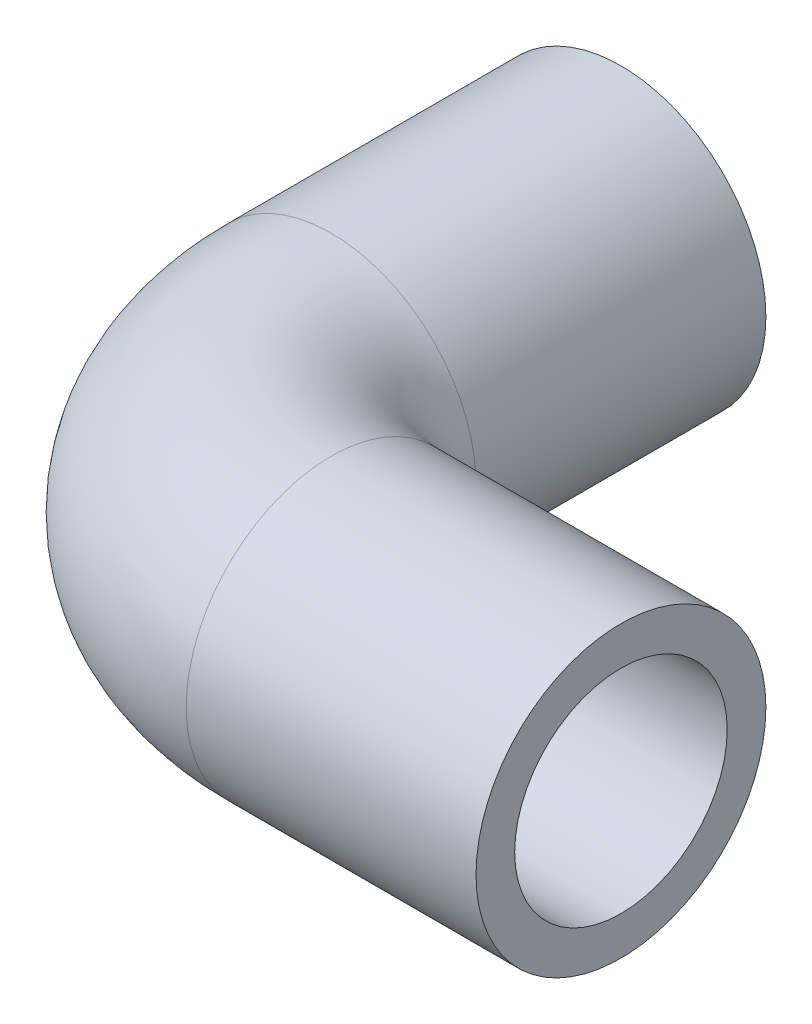
from build123d import *

# Parameters (mm, degrees)
SWEEP1_PROFILE_R   = 37.5
SHELL1_T           = -10
CUT_EXTRUDE1_REACH = 234.849


with BuildPart() as part:
    # Sweep1: sweep along a path in Sketch1
    with BuildLine(Plane(origin=(0, 0, 0), x_dir=(1, 0, 0), z_dir=(0, 1, 0))) as sweep1_path:
        Line((0, 0), (-75, 0))
        ThreePointArc((-75, 0), (-110.355339059, 14.644660941), (-125, 50))
        Line((-125, 50), (-125, 125))
    # Sweep1 profile (on start of the path) → Sweep1 (sweep)
    with BuildSketch(Plane(origin=(0, 0, 0), x_dir=(0, 0, -1), z_dir=(-1, 0, 0))):
        Circle(SWEEP1_PROFILE_R)
    sweep(path=sweep1_path.line)

    # Shell1
    shell1_openings = [part.faces().sort_by_distance(p)[0] for p in [
        (0, 0, 0),
    ]]
    offset(amount=SHELL1_T, openings=shell1_openings, kind=Kind.INTERSECTION)

    # Sketch6 → Cut-Extrude1 (cut, up to next)
    with BuildSketch(Plane(origin=(0, 0, -125), x_dir=(-1, 0, 0), z_dir=(0, 0, -1)), mode=Mode.PRIVATE) as cut_extrude1_sk1:
        with BuildLine():
            ThreePointArc((125, 27.5), (105.554563517, -19.445436483), (152.5, 0))
            ThreePointArc((152.5, 0), (144.445436483, 19.445436483), (125, 27.5))
        make_face()
    cut_extrude1_tool1 = extrude(cut_extrude1_sk1.sketch, amount=-CUT_EXTRUDE1_REACH, mode=Mode.PRIVATE) & part.part
    add(cut_extrude1_tool1.solids().sort_by_distance((-125, 0, -125))[0], mode=Mode.SUBTRACT)


solid = part.part
